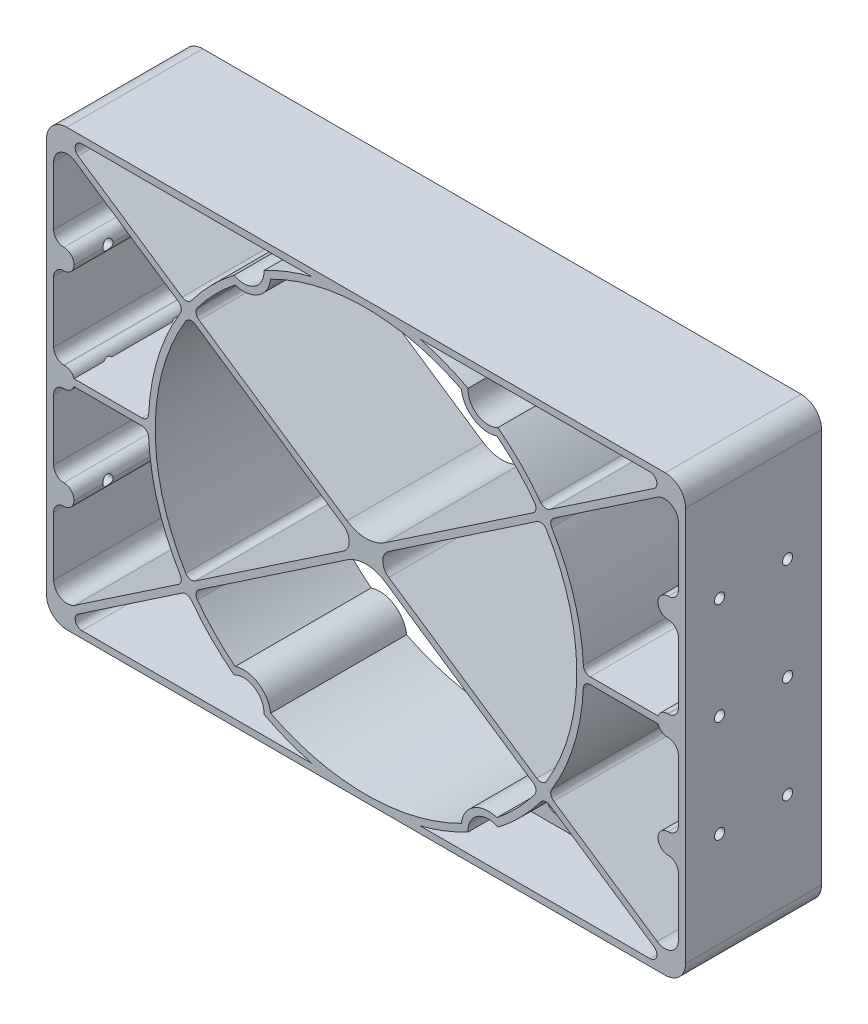
from build123d import *

# Parameters (mm, degrees)
BOSS_EXTRUDE1_DEPTH     = 20
FILLET1_R               = 1
FILLET2_R               = 2
FILLET3_R               = 5
SKETCH3_R               = 1.4
BOSS_EXTRUDE2_DEPTH     = 10
FILLET4_R               = 2
SKETCH4_R               = 0.75
CUT_EXTRUDE1_DEPTH      = 4
BOSS_EXTRUDE3_START     = -1.058475
SKETCH5_W               = 20
SKETCH5_H               = 3
SKETCH5_R               = 0.75
BOSS_EXTRUDE3_DEPTH     = 3
FILLET5_R               = 1.5
CUT_EXTRUDE2_START      = -1.058474548
SKETCH6_R               = 0.75
CUT_EXTRUDE2_DEPTH      = 1.058474548
BOSS_EXTRUDE4_START     = -4.058474548
BOSS_EXTRUDE4_OUTLINE_W = 20
BOSS_EXTRUDE4_OUTLINE_H = 3
BOSS_EXTRUDE4_OUTLINE_R = 0.75
BOSS_EXTRUDE4_DEPTH     = 3
FILLET6_R               = 1.5


with BuildPart() as part:
    # Sketch1 → Boss-Extrude1 (new body)
    with BuildSketch(Plane.XY):
        with BuildLine():
            ThreePointArc((-47, -29), (-46.121320344, -31.121320344), (-44, -32))
            Line((-44, -32), (44, -32))
            ThreePointArc((44, -32), (46.121320344, -31.121320344), (47, -29))
            Line((47, -29), (47, 29))
            ThreePointArc((47, 29), (46.121320344, 31.121320344), (44, 32))
            Line((44, 32), (-44, 32))
            ThreePointArc((-44, 32), (-46.121320344, 31.121320344), (-47, 29))
            Line((-47, 29), (-47, -29))
        make_face()
        with BuildLine():
            Line((-45.04761849, -31), (-26.243067108, -18.311237772))
            ThreePointArc((-26.243067108, -18.311237772), (-23.099583726, -22.145185294), (-19.401605633, -25.447547993))
            ThreePointArc((-19.401605633, -25.447547993), (-16.381818623, -25.573839073), (-15.004497042, -28.264201183))
            ThreePointArc((-15.004497042, -28.264201183), (-11.552148425, -29.842048635), (-7.937253933, -31))
            Line((-7.937253933, -31), (-45.04761849, -31))
        make_face(mode=Mode.SUBTRACT)
        with BuildLine():
            ThreePointArc((-31.996093512, -0.5), (-30.600908876, -9.358652464), (-26.802409435, -17.482301007))
            Line((-26.802409435, -17.482301007), (-45.941525452, -30.396817682))
            Line((-45.941525452, -30.396817682), (-45.941525452, -0.5))
            Line((-45.941525452, -0.5), (-31.996093512, -0.5))
        make_face(mode=Mode.SUBTRACT)
        with BuildLine():
            Line((0, -0.603182318), (25.41402587, -17.751824951))
            ThreePointArc((25.41402587, -17.751824951), (22.570115199, -21.250644694), (19.248742842, -24.299915617))
            ThreePointArc((19.248742842, -24.299915617), (15.842424831, -24.73178543), (14.025904476, -27.645506029))
            ThreePointArc((14.025904476, -27.645506029), (0, -31), (-14.025904476, -27.645506029))
            ThreePointArc((-14.025904476, -27.645506029), (-15.842424831, -24.73178543), (-19.248742842, -24.299915617))
            ThreePointArc((-19.248742842, -24.299915617), (-22.570115199, -21.250644694), (-25.41402587, -17.751824951))
            Line((-25.41402587, -17.751824951), (0, -0.603182318))
        make_face(mode=Mode.SUBTRACT)
        with BuildLine():
            Line((26.802409435, 17.482301007), (45.941525452, 30.396817682))
            Line((45.941525452, 30.396817682), (45.941525452, 0.5))
            Line((45.941525452, 0.5), (31.996093512, 0.5))
            ThreePointArc((31.996093512, 0.5), (30.600908876, 9.358652464), (26.802409435, 17.482301007))
        make_face(mode=Mode.SUBTRACT)
        with BuildLine():
            Line((45.941525452, -0.5), (45.941525452, -30.396817682))
            Line((45.941525452, -30.396817682), (26.802409435, -17.482301007))
            ThreePointArc((26.802409435, -17.482301007), (30.600908876, -9.358652464), (31.996093512, -0.5))
            Line((31.996093512, -0.5), (45.941525452, -0.5))
        make_face(mode=Mode.SUBTRACT)
        with BuildLine():
            Line((45.04761849, -31), (7.937253933, -31))
            ThreePointArc((7.937253933, -31), (11.552148425, -29.842048635), (15.004497042, -28.264201183))
            ThreePointArc((15.004497042, -28.264201183), (16.381818623, -25.573839073), (19.401605633, -25.447547993))
            ThreePointArc((19.401605633, -25.447547993), (23.099583726, -22.145185294), (26.243067108, -18.311237772))
            Line((26.243067108, -18.311237772), (45.04761849, -31))
        make_face(mode=Mode.SUBTRACT)
        with BuildLine():
            Line((-45.941525452, 30.396817682), (-26.802409435, 17.482301007))
            ThreePointArc((-26.802409435, 17.482301007), (-30.600908876, 9.358652464), (-31.996093512, 0.5))
            Line((-31.996093512, 0.5), (-45.941525452, 0.5))
            Line((-45.941525452, 0.5), (-45.941525452, 30.396817682))
        make_face(mode=Mode.SUBTRACT)
        with BuildLine():
            Line((-25.973368197, 16.922888185), (-0.893906962, 0))
            Line((-0.893906962, 0), (-25.973368197, -16.922888185))
            ThreePointArc((-25.973368197, -16.922888185), (-31, 0), (-25.973368197, 16.922888185))
        make_face(mode=Mode.SUBTRACT)
        with BuildLine():
            ThreePointArc((-19.401605633, 25.447547993), (-23.099583726, 22.145185294), (-26.243067108, 18.311237772))
            Line((-26.243067108, 18.311237772), (-45.04761849, 31))
            Line((-45.04761849, 31), (-7.937253933, 31))
            ThreePointArc((-7.937253933, 31), (-11.552148425, 29.842048635), (-15.004497042, 28.264201183))
            ThreePointArc((-15.004497042, 28.264201183), (-16.381818623, 25.573839073), (-19.401605633, 25.447547993))
        make_face(mode=Mode.SUBTRACT)
        with BuildLine():
            Line((25.41402587, 17.751824951), (0, 0.603182318))
            Line((0, 0.603182318), (-25.41402587, 17.751824951))
            ThreePointArc((-25.41402587, 17.751824951), (-22.570115199, 21.250644694), (-19.248742842, 24.299915617))
            ThreePointArc((-19.248742842, 24.299915617), (-15.842424831, 24.73178543), (-14.025904476, 27.645506029))
            ThreePointArc((-14.025904476, 27.645506029), (0, 31), (14.025904476, 27.645506029))
            ThreePointArc((14.025904476, 27.645506029), (15.842424831, 24.73178543), (19.248742842, 24.299915617))
            ThreePointArc((19.248742842, 24.299915617), (22.570115199, 21.250644694), (25.41402587, 17.751824951))
        make_face(mode=Mode.SUBTRACT)
        with BuildLine():
            Line((25.973368197, -16.922888185), (0.893906962, 0))
            Line((0.893906962, 0), (25.973368197, 16.922888185))
            ThreePointArc((25.973368197, 16.922888185), (31, 0), (25.973368197, -16.922888185))
        make_face(mode=Mode.SUBTRACT)
        with BuildLine():
            Line((45.04761849, 31), (26.243067108, 18.311237772))
            ThreePointArc((26.243067108, 18.311237772), (23.099583726, 22.145185294), (19.401605633, 25.447547993))
            ThreePointArc((19.401605633, 25.447547993), (16.381818623, 25.573839073), (15.004497042, 28.264201183))
            ThreePointArc((15.004497042, 28.264201183), (11.552148425, 29.842048635), (7.937253933, 31))
            Line((7.937253933, 31), (45.04761849, 31))
        make_face(mode=Mode.SUBTRACT)
    extrude(amount=BOSS_EXTRUDE1_DEPTH)

    # Fillet1
    fillet1_edges = [part.edges().sort_by_distance(p)[0] for p in [
        (-45.04761849, -31, 10),
        (-26.243067108, -18.311237772, 10),
        (45.04761849, -31, 10),
        (26.243067108, -18.311237772, 10),
        (-45.941525452, 0.5, 10),
        (-31.996093512, 0.5, 10),
        (-26.802409435, 17.482301007, 10),
        (45.04761849, 31, 10),
        (26.243067108, 18.311237772, 10),
        (-45.04761849, 31, 10),
        (-26.243067108, 18.311237772, 10),
        (-31.996093512, -0.5, 10),
        (-45.941525452, -0.5, 10),
        (-26.802409435, -17.482301007, 10),
        (25.41402587, -17.751824951, 10),
        (-25.41402587, -17.751824951, 10),
        (45.941525452, -0.5, 10),
        (31.996093512, -0.5, 10),
        (26.802409435, -17.482301007, 10),
        (31.996093512, 0.5, 10),
        (45.941525452, 0.5, 10),
        (26.802409435, 17.482301007, 10),
        (-25.973368197, 16.922888185, 10),
        (-25.973368197, -16.922888185, 10),
        (25.973368197, -16.922888185, 10),
        (25.973368197, 16.922888185, 10),
        (25.41402587, 17.751824951, 10),
        (-25.41402587, 17.751824951, 10),
    ]]
    fillet(fillet1_edges, radius=FILLET1_R)

    # Fillet2
    fillet2_edges = [part.edges().sort_by_distance(p)[0] for p in [
        (-45.941525452, 30.396817682, 10),
        (-45.941525452, -30.396817682, 10),
        (45.941525452, -30.396817682, 10),
        (45.941525452, 30.396817682, 10),
        (-0.893906962, 0, 10),
        (0.893906962, 0, 10),
    ]]
    fillet(fillet2_edges, radius=FILLET2_R)

    # Fillet3
    fillet3_edges = [part.edges().sort_by_distance(p)[0] for p in [
        (0, -0.603182318, 10),
        (0, 0.603182318, 10),
    ]]
    fillet(fillet3_edges, radius=FILLET3_R)

    # Sketch3 → Boss-Extrude2 (add)
    # profile 1 of 4: a face of its own
    with BuildSketch(Plane.XY):
        with BuildLine():
            Line((-7.937253933, 31), (-21, 31))
            Line((-21, 31), (-21, 28.1))
            ThreePointArc((-21, 28.1), (-21.417711667, 25.239973725), (-22.635950059, 22.618880718))
            ThreePointArc((-22.635950059, 22.618880718), (-21.066308689, 24.087561899), (-19.401605633, 25.447547993))
            ThreePointArc((-19.401605633, 25.447547993), (-16.381818623, 25.573839073), (-15.004497042, 28.264201183))
            ThreePointArc((-15.004497042, 28.264201183), (-11.552148425, 29.842048635), (-7.937253933, 31))
        make_face()
        with Locations((-18, 28.1)):
            Circle(SKETCH3_R, mode=Mode.SUBTRACT)
    # profile 2 of 4: a face of its own
    with BuildSketch(Plane.XY):
        with BuildLine():
            Line((21, 28.1), (21, 31))
            Line((21, 31), (7.937253933, 31))
            ThreePointArc((7.937253933, 31), (11.552148425, 29.842048635), (15.004497042, 28.264201183))
            ThreePointArc((15.004497042, 28.264201183), (16.381818623, 25.573839073), (19.401605633, 25.447547993))
            ThreePointArc((19.401605633, 25.447547993), (21.066308689, 24.087561899), (22.635950059, 22.618880718))
            ThreePointArc((22.635950059, 22.618880718), (21.417711667, 25.239973725), (21, 28.1))
        make_face()
        with Locations((18, 28.1)):
            Circle(SKETCH3_R, mode=Mode.SUBTRACT)
    # profile 3 of 4: a face of its own
    with BuildSketch(Plane.XY):
        with BuildLine():
            Line((7.937253933, -31), (21, -31))
            Line((21, -31), (21, -28.1))
            ThreePointArc((21, -28.1), (21.417711667, -25.239973725), (22.635950059, -22.618880718))
            ThreePointArc((22.635950059, -22.618880718), (21.066308689, -24.087561899), (19.401605633, -25.447547993))
            ThreePointArc((19.401605633, -25.447547993), (16.381818623, -25.573839073), (15.004497042, -28.264201183))
            ThreePointArc((15.004497042, -28.264201183), (11.552148425, -29.842048635), (7.937253933, -31))
        make_face()
        with Locations((18, -28.1)):
            Circle(SKETCH3_R, mode=Mode.SUBTRACT)
    # profile 4 of 4: a face of its own
    with BuildSketch(Plane.XY):
        with BuildLine():
            Line((-21, -28.1), (-21, -31))
            Line((-21, -31), (-7.937253933, -31))
            ThreePointArc((-7.937253933, -31), (-11.552148425, -29.842048635), (-15.004497042, -28.264201183))
            ThreePointArc((-15.004497042, -28.264201183), (-16.381818623, -25.573839073), (-19.401605633, -25.447547993))
            ThreePointArc((-19.401605633, -25.447547993), (-21.066308689, -24.087561899), (-22.635950059, -22.618880718))
            ThreePointArc((-22.635950059, -22.618880718), (-21.417711667, -25.239973725), (-21, -28.1))
        make_face()
        with Locations((-18, -28.1)):
            Circle(SKETCH3_R, mode=Mode.SUBTRACT)
    extrude(amount=BOSS_EXTRUDE2_DEPTH)

    # Fillet4
    fillet4_edges = [part.edges().sort_by_distance(p)[0] for p in [
        (-21, 31, 5),
        (21, 31, 5),
        (21, -31, 5),
        (-21, -31, 5),
    ]]
    fillet(fillet4_edges, radius=FILLET4_R)

    # Sketch4 → Cut-Extrude1 (cut)
    with BuildSketch(Plane(origin=(47, 0, 0), x_dir=(0, 0, -1), z_dir=(1, 0, 0))):
        with Locations((-15, 15)):
            Circle(SKETCH4_R)
        with Locations((-5, 15)):
            Circle(SKETCH4_R)
        with Locations((-15, 0)):
            Circle(SKETCH4_R)
        with Locations((-5, 0)):
            Circle(SKETCH4_R)
        with Locations((-15, -15)):
            Circle(SKETCH4_R)
        with Locations((-5, -15)):
            Circle(SKETCH4_R)
    extrude(amount=-CUT_EXTRUDE1_DEPTH, mode=Mode.SUBTRACT)


with BuildPart() as boss_extrude3_tool:
    # Sketch5 → Boss-Extrude3 (new body)
    # profile 1 of 3: a face of its own
    with BuildSketch(Plane(origin=(47, 0, 0), x_dir=(0, 0, -1), z_dir=(1, 0, 0)).offset(BOSS_EXTRUDE3_START)):
        with Locations((-10, 15)):
            Rectangle(SKETCH5_W, SKETCH5_H)
        with Locations((-15, 15)):
            Circle(SKETCH5_R, mode=Mode.SUBTRACT)
        with Locations((-5, 15)):
            Circle(SKETCH5_R, mode=Mode.SUBTRACT)
    # profile 2 of 3: a face of its own
    with BuildSketch(Plane(origin=(47, 0, 0), x_dir=(0, 0, -1), z_dir=(1, 0, 0)).offset(BOSS_EXTRUDE3_START)):
        with Locations((-10, 0)):
            Rectangle(SKETCH5_W, SKETCH5_H)
        with Locations((-15, 0)):
            Circle(SKETCH5_R, mode=Mode.SUBTRACT)
        with Locations((-5, 0)):
            Circle(SKETCH5_R, mode=Mode.SUBTRACT)
    # profile 3 of 3: a face of its own
    with BuildSketch(Plane(origin=(47, 0, 0), x_dir=(0, 0, -1), z_dir=(1, 0, 0)).offset(BOSS_EXTRUDE3_START)):
        with Locations((-10, -15)):
            Rectangle(SKETCH5_W, SKETCH5_H)
        with Locations((-15, -15)):
            Circle(SKETCH5_R, mode=Mode.SUBTRACT)
        with Locations((-5, -15)):
            Circle(SKETCH5_R, mode=Mode.SUBTRACT)
    extrude(amount=-BOSS_EXTRUDE3_DEPTH)


with BuildPart() as part_1:
    add(part.part)


with BuildPart() as part_2:
    # Boss-Extrude3: joined with boss_extrude3_tool
    add(part_1.part.fuse(boss_extrude3_tool.part, tol=0.00001))

    # Fillet5
    # the kernel refuses this fillet: 1.5 mm, written as the material it adds along each edge
    with BuildSketch(Plane(origin=(45.941525, -16.5, 20), x_dir=(3.010518412338433e-07, -0.9999999999999547, 0), z_dir=(0, 0, -1)), Plane(origin=(45.941525, 13.5, 20), x_dir=(3.010518412338433e-07, -0.9999999999999547, 0), z_dir=(0, 0, -1))) as fillet5_piece_1:
        with BuildLine():
            CenterArc((FILLET5_R * 0.999999698948, FILLET5_R), FILLET5_R, 180.000017249, 90)
            Line((-FILLET5_R * 3.01051750602e-07, FILLET5_R * 0.999999698948), (0, 0))
            Line((0, 0), (FILLET5_R, 0))
        make_face()
    extrude(amount=20)
    with BuildSketch(Plane(origin=(45.941525, -13.5, 0), x_dir=(-1, 0, 0), z_dir=(0, 0, 1)), Plane(origin=(45.941525, 16.5, 0), x_dir=(-1, 0, 0), z_dir=(0, 0, 1))) as fillet5_piece_2:
        with BuildLine():
            CenterArc((FILLET5_R * 0.999999698948, -FILLET5_R), FILLET5_R, 90, 90)
            Line((-FILLET5_R * 3.01051841234e-07, -FILLET5_R), (0, 0))
            Line((0, 0), (FILLET5_R * 0.999999698948, 0))
        make_face()
    extrude(amount=20)
    with BuildSketch(Plane(origin=(45.941525452, -1.5, 0), x_dir=(0, -1, 0), z_dir=(0, 0, 1)), Plane(origin=(45.941525452, 1.5, 0), x_dir=(-1, 0, 0), z_dir=(0, 0, 1))) as fillet5_piece_3:
        with BuildLine():
            CenterArc((FILLET5_R, -FILLET5_R), FILLET5_R, 90, 90)
            Line((0, -FILLET5_R), (0, 0))
            Line((0, 0), (FILLET5_R, 0))
        make_face()
    extrude(amount=20)
    # the kernel refuses this fillet: 1.5 mm, written as the material it takes off along each edge
    with BuildSketch(Plane(origin=(42.941525, -16.5, 23.75), x_dir=(0, 1, 0), z_dir=(0, 0, -1)), Plane(origin=(42.941525, 13.5, 23.75), x_dir=(0, 1, 0), z_dir=(0, 0, -1))) as fillet5_2_piece_1:
        with BuildLine():
            CenterArc((FILLET5_R, FILLET5_R), FILLET5_R, 180, 90)
            Line((0, FILLET5_R), (0, 0))
            Line((0, 0), (FILLET5_R, 0))
        make_face()
    extrude(amount=27.5, mode=Mode.SUBTRACT)
    with BuildSketch(Plane(origin=(42.941525, -13.5, -3.75), x_dir=(1, 0, 0), z_dir=(0, 0, 1)), Plane(origin=(42.941525, 16.5, -3.75), x_dir=(1, 0, 0), z_dir=(0, 0, 1))) as fillet5_2_piece_2:
        with BuildLine():
            CenterArc((FILLET5_R, -FILLET5_R), FILLET5_R, 90, 90)
            Line((0, -FILLET5_R), (0, 0))
            Line((0, 0), (FILLET5_R, 0))
        make_face()
    extrude(amount=27.5, mode=Mode.SUBTRACT)
    with BuildSketch(Plane(origin=(42.941525, -1.5, 23.535533906), x_dir=(0, 1, 0), z_dir=(0, 0, -1))) as fillet5_2_piece_3:
        with BuildLine():
            CenterArc((1.5, 1.414213562), FILLET5_R, 180, 70.528779366)
            Line((0, 1.414213562), (0, 0))
            Line((0, 0), (1, 0))
        make_face()
    extrude(amount=27.071067812, mode=Mode.SUBTRACT)
    with BuildSketch(Plane(origin=(42.941525, 1.5, -3.535533906), x_dir=(1, 0, 0), z_dir=(0, 0, 1))) as fillet5_2_piece_4:
        with BuildLine():
            CenterArc((1.414213562, -1.5), FILLET5_R, 90, 70.528779366)
            Line((0, -1), (0, 0))
            Line((0, 0), (1.414213562, 0))
        make_face()
    extrude(amount=27.071067812, mode=Mode.SUBTRACT)

    # Sketch6 → Cut-Extrude2 (cut)
    with BuildSketch(Plane.ZY.offset(47).offset(CUT_EXTRUDE2_START)):
        with Locations(Location((5, 15, 0), (0, 0, 180))):
            Circle(SKETCH6_R)
        with Locations(Location((15, 15, 0), (0, 0, 180))):
            Circle(SKETCH6_R)
        with Locations(Location((15, 0, 0), (0, 0, 180))):
            Circle(SKETCH6_R)
        with Locations(Location((15, -15, 0), (0, 0, 180))):
            Circle(SKETCH6_R)
        with Locations(Location((5, 0, 0), (0, 0, 180))):
            Circle(SKETCH6_R)
        with Locations(Location((5, -15, 0), (0, 0, 180))):
            Circle(SKETCH6_R)
    extrude(amount=CUT_EXTRUDE2_DEPTH, mode=Mode.SUBTRACT)

    # Boss-Extrude4: read off the stored shape, not the designer's step
    # Boss-Extrude4 outline → Boss-Extrude4 (add)
    # profile 1 of 4: a face of its own
    with BuildSketch(Plane.ZY.offset(47).offset(BOSS_EXTRUDE4_START)):
        with Locations((10, -15)):
            Rectangle(BOSS_EXTRUDE4_OUTLINE_W, BOSS_EXTRUDE4_OUTLINE_H)
        with Locations((5, -15)):
            Circle(BOSS_EXTRUDE4_OUTLINE_R, mode=Mode.SUBTRACT)
        with Locations((15, -15)):
            Circle(BOSS_EXTRUDE4_OUTLINE_R, mode=Mode.SUBTRACT)
    # profile 2 of 4: a face of its own
    with BuildSketch(Plane.ZY.offset(47).offset(BOSS_EXTRUDE4_START)):
        with BuildLine():
            Line((0, -1.5), (20, -1.5))
            Line((20, -1.5), (20, -0.5))
            Line((20, -0.5), (15.559016994, -0.5))
            ThreePointArc((15.559016994, -0.5), (15, -0.75), (14.440983006, -0.5))
            Line((14.440983006, -0.5), (5.559016994, -0.5))
            ThreePointArc((5.559016994, -0.5), (5, -0.75), (4.440983006, -0.5))
            Line((4.440983006, -0.5), (0, -0.5))
            Line((0, -0.5), (0, -1.5))
        make_face()
    # profile 3 of 4: a face of its own
    with BuildSketch(Plane.ZY.offset(47).offset(BOSS_EXTRUDE4_START)):
        with BuildLine():
            Line((15.559016994, 0.5), (20, 0.5))
            Line((20, 0.5), (20, 1.5))
            Line((20, 1.5), (0, 1.5))
            Line((0, 1.5), (0, 0.5))
            Line((0, 0.5), (4.440983006, 0.5))
            ThreePointArc((4.440983006, 0.5), (5, 0.75), (5.559016994, 0.5))
            Line((5.559016994, 0.5), (14.440983006, 0.5))
            ThreePointArc((14.440983006, 0.5), (15, 0.75), (15.559016994, 0.5))
        make_face()
    # profile 4 of 4: a face of its own
    with BuildSketch(Plane.ZY.offset(47).offset(BOSS_EXTRUDE4_START)):
        with Locations((10, 15)):
            Rectangle(BOSS_EXTRUDE4_OUTLINE_W, BOSS_EXTRUDE4_OUTLINE_H)
        with Locations((5, 15)):
            Circle(BOSS_EXTRUDE4_OUTLINE_R, mode=Mode.SUBTRACT)
        with Locations((15, 15)):
            Circle(BOSS_EXTRUDE4_OUTLINE_R, mode=Mode.SUBTRACT)
    extrude(amount=BOSS_EXTRUDE4_DEPTH)

    # Fillet6
    # the kernel refuses this fillet: 1.5 mm, written as the material it adds along each edge
    with BuildSketch(Plane(origin=(-45.941525452, -13.5, 20), x_dir=(2.814980841018648e-10, 1.0, 0), z_dir=(0, 0, -1)), Plane(origin=(-45.941525452, -16.5, 0), x_dir=(2.814980841018648e-10, -1.0, 0), z_dir=(0, 0, 1)), Plane(origin=(-45.941525452, 13.5, 0), x_dir=(2.815075580050082e-10, -1.0, 0), z_dir=(0, 0, 1)), Plane(origin=(-45.941525452, 16.5, 20), x_dir=(2.815075580050082e-10, 1.0, 0), z_dir=(0, 0, -1))) as fillet6_piece_1:
        with BuildLine():
            CenterArc((FILLET6_R, FILLET6_R), FILLET6_R, 179.999999984, 90)
            Line((FILLET6_R * 2.81498084181e-10, FILLET6_R), (0, 0))
            Line((0, 0), (FILLET6_R, 0))
        make_face()
    extrude(amount=20)
    with BuildSketch(Plane(origin=(-45.941525452, -1.5, 0), x_dir=(0, -1, 0), z_dir=(0, 0, 1))) as fillet6_piece_2:
        with BuildLine():
            CenterArc((FILLET6_R, FILLET6_R), FILLET6_R, 180, 90)
            Line((0, FILLET6_R), (0, 0))
            Line((0, 0), (FILLET6_R, 0))
        make_face()
    extrude(amount=20)
    with BuildSketch(Plane(origin=(-45.941525452, 1.5, 0), x_dir=(0, 1, 0), z_dir=(0, 0, 1))) as fillet6_piece_3:
        with BuildLine():
            CenterArc((FILLET6_R, -FILLET6_R), FILLET6_R, 90, 90)
            Line((0, -FILLET6_R), (0, 0))
            Line((0, 0), (FILLET6_R, 0))
        make_face()
    extrude(amount=20)
    # the kernel refuses this fillet: 1.5 mm, written as the material it takes off along each edge
    with BuildSketch(Plane(origin=(-42.941525452, -13.5, 23.75), x_dir=(0, -1, 0), z_dir=(0, 0, -1)), Plane(origin=(-42.941525452, 16.5, 23.75), x_dir=(0, -1, 0), z_dir=(0, 0, -1))) as fillet6_2_piece_1:
        with BuildLine():
            CenterArc((FILLET6_R, FILLET6_R), FILLET6_R, 180, 90)
            Line((0, FILLET6_R), (0, 0))
            Line((0, 0), (FILLET6_R, 0))
        make_face()
    extrude(amount=27.5, mode=Mode.SUBTRACT)
    with BuildSketch(Plane(origin=(-42.941525452, -16.5, -3.75), x_dir=(-1, 0, 0), z_dir=(0, 0, 1)), Plane(origin=(-42.941525452, 13.5, -3.75), x_dir=(-1, 0, 0), z_dir=(0, 0, 1))) as fillet6_2_piece_2:
        with BuildLine():
            CenterArc((FILLET6_R, -FILLET6_R), FILLET6_R, 90, 90)
            Line((0, -FILLET6_R), (0, 0))
            Line((0, 0), (FILLET6_R, 0))
        make_face()
    extrude(amount=27.5, mode=Mode.SUBTRACT)
    with BuildSketch(Plane(origin=(-42.941525452, -1.5, -3.535533906), x_dir=(-1, 0, 0), z_dir=(0, 0, 1))) as fillet6_2_piece_3:
        with BuildLine():
            CenterArc((1.414213562, -1.5), FILLET6_R, 90, 70.528779366)
            Line((0, -1), (0, 0))
            Line((0, 0), (1.414213562, 0))
        make_face()
    extrude(amount=27.071067812, mode=Mode.SUBTRACT)
    with BuildSketch(Plane(origin=(-42.941525452, 1.5, 23.535533906), x_dir=(0, -1, 0), z_dir=(0, 0, -1))) as fillet6_2_piece_4:
        with BuildLine():
            CenterArc((1.5, 1.414213562), FILLET6_R, 180, 70.528779366)
            Line((0, 1.414213562), (0, 0))
            Line((0, 0), (1, 0))
        make_face()
    extrude(amount=27.071067812, mode=Mode.SUBTRACT)


solid = part_2.part
